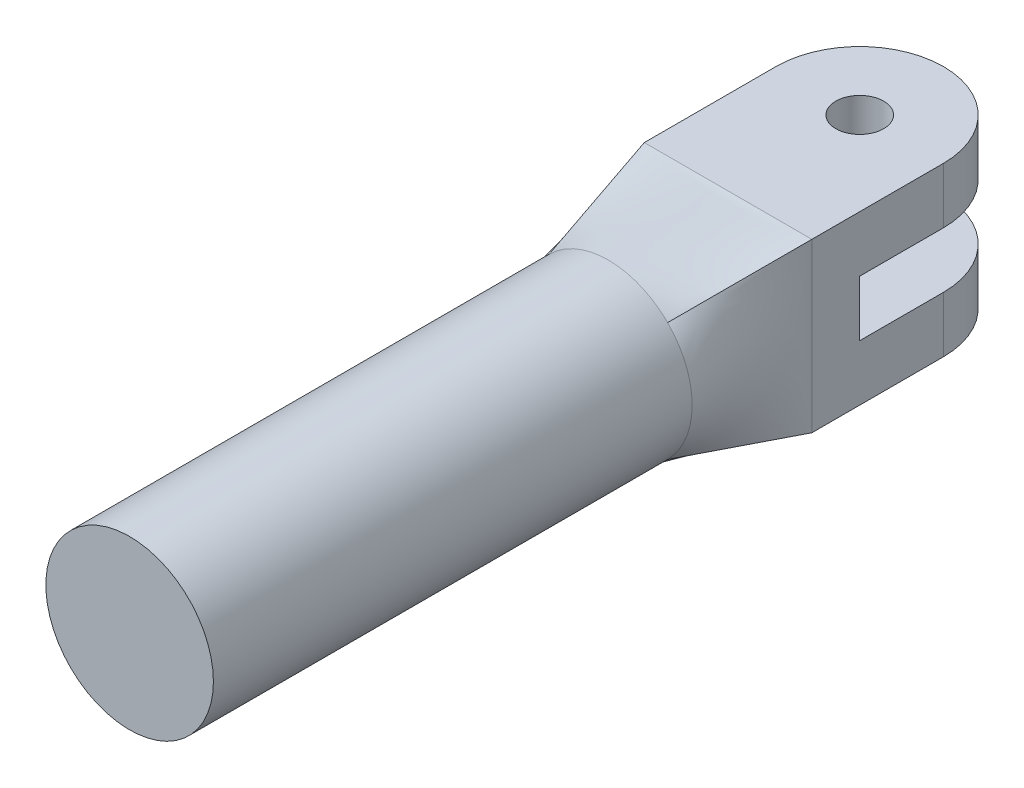
from build123d import *

# Parameters (mm, degrees)
SKETCH1_R           = 3.5
BOSS_EXTRUDE1_DEPTH = 20
SKETCH3_2_W         = 7
SKETCH3_2_H         = 7
BOSS_EXTRUDE3_DEPTH = 2
SKETCH4_W           = 7
SKETCH4_H           = 2.333333333
BOSS_EXTRUDE2_DEPTH = 7
SKETCH5_R           = 1
CUT_EXTRUDE1_DEPTH  = 35.889110176
FILLET1_R           = 3.5


with BuildPart() as part:
    # Sketch1 → Boss-Extrude1 (new body)
    with BuildSketch(Plane.XY):
        Circle(SKETCH1_R)
    extrude(amount=-BOSS_EXTRUDE1_DEPTH)

    # Loft1: read off the stored shape, not the designer's step
    # Loft1: loft between two sections, ruled curve by curve
    loft1_from = [
        Edge.make_bspline([(-3.5, 3.5, -25), (-3.5, 2.916666667, -25), (-3.5, 2.333333333, -25), (-3.5, 1.166666667, -25), (-3.5, 0.583333333, -25), (-3.5, -0.583333333, -25), (-3.5, -1.166666667, -25), (-3.5, -2.333333333, -25), (-3.5, -2.916666667, -25), (-3.5, -3.5, -25)], [0, 0, 0, 0, 0.25, 0.25, 0.5, 0.5, 0.75, 0.75, 1, 1, 1, 1], 3),
        Edge.make_bspline([(-3.5, -3.5, -25), (-2.916666667, -3.5, -25), (-2.333333333, -3.5, -25), (-1.166666667, -3.5, -25), (-0.583333333, -3.5, -25), (0.583333333, -3.5, -25), (1.166666667, -3.5, -25), (2.333333333, -3.5, -25), (2.916666667, -3.5, -25), (3.5, -3.5, -25)], [0, 0, 0, 0, 0.25, 0.25, 0.5, 0.5, 0.75, 0.75, 1, 1, 1, 1], 3),
        Edge.make_bspline([(3.5, 3.5, -25), (2.916666667, 3.5, -25), (2.333333333, 3.5, -25), (1.166666667, 3.5, -25), (0.583333333, 3.5, -25), (-0.583333333, 3.5, -25), (-1.166666667, 3.5, -25), (-2.333333333, 3.5, -25), (-2.916666667, 3.5, -25), (-3.5, 3.5, -25)], [0, 0, 0, 0, 0.25, 0.25, 0.5, 0.5, 0.75, 0.75, 1, 1, 1, 1], 3),
        Edge.make_bspline([(3.5, -3.5, -25), (3.5, -2.916666667, -25), (3.5, -2.333333333, -25), (3.5, -1.166666667, -25), (3.5, -0.583333333, -25), (3.5, 0.583333333, -25), (3.5, 1.166666667, -25), (3.5, 2.333333333, -25), (3.5, 2.916666667, -25), (3.5, 3.5, -25)], [0, 0, 0, 0, 0.25, 0.25, 0.5, 0.5, 0.75, 0.75, 1, 1, 1, 1], 3),
    ]
    loft1_to = [
        Edge.make_bspline([(-2.474873734, 2.474873734, -20), (-2.766540401, 2.183207067, -20), (-3.028055087, 1.815378049, -20), (-3.396138059, 0.964863384, -20), (-3.5, 0.483249156, -20), (-3.5, -0.483249156, -20), (-3.396138059, -0.964863384, -20), (-3.028055087, -1.815378049, -20), (-2.766540401, -2.183207067, -20), (-2.474873734, -2.474873734, -20)], [0, 0, 0, 0, 0.25, 0.25, 0.5, 0.5, 0.75, 0.75, 1, 1, 1, 1], 3),
        Edge.make_bspline([(-2.474873734, -2.474873734, -20), (-2.183207067, -2.766540401, -20), (-1.815378049, -3.028055087, -20), (-0.964863384, -3.396138059, -20), (-0.483249156, -3.5, -20), (0.483249156, -3.5, -20), (0.964863384, -3.396138059, -20), (1.815378049, -3.028055087, -20), (2.183207067, -2.766540401, -20), (2.474873734, -2.474873734, -20)], [0, 0, 0, 0, 0.25, 0.25, 0.5, 0.5, 0.75, 0.75, 1, 1, 1, 1], 3),
        Edge.make_bspline([(2.474873734, 2.474873734, -20), (2.183207067, 2.766540401, -20), (1.815378049, 3.028055087, -20), (0.964863384, 3.396138059, -20), (0.483249156, 3.5, -20), (-0.483249156, 3.5, -20), (-0.964863384, 3.396138059, -20), (-1.815378049, 3.028055087, -20), (-2.183207067, 2.766540401, -20), (-2.474873734, 2.474873734, -20)], [0, 0, 0, 0, 0.25, 0.25, 0.5, 0.5, 0.75, 0.75, 1, 1, 1, 1], 3),
        Edge.make_bspline([(2.474873734, -2.474873734, -20), (2.766540401, -2.183207067, -20), (3.028055087, -1.815378049, -20), (3.396138059, -0.964863384, -20), (3.5, -0.483249156, -20), (3.5, 0.483249156, -20), (3.396138059, 0.964863384, -20), (3.028055087, 1.815378049, -20), (2.766540401, 2.183207067, -20), (2.474873734, 2.474873734, -20)], [0, 0, 0, 0, 0.25, 0.25, 0.5, 0.5, 0.75, 0.75, 1, 1, 1, 1], 3),
    ]
    loft1 = Solid(Shell([*[Face.make_surface_from_curves(loft1_from[k], loft1_to[k]) for k in range(4)], Face(Wire(loft1_from)), Face(Wire(loft1_to))]))
    add(loft1)

    # Sketch3<2> → Boss-Extrude3 (add)
    with BuildSketch(Plane(origin=(0, 0, -25), x_dir=(-1, 0, 0), z_dir=(0, 0, -1))):
        Rectangle(SKETCH3_2_W, SKETCH3_2_H)
    extrude(amount=BOSS_EXTRUDE3_DEPTH)

    # Sketch4 → Boss-Extrude2 (add)
    with BuildSketch(Plane(origin=(0, 0, -27), x_dir=(-1, 0, 0), z_dir=(0, 0, -1))):
        with Locations((0, 2.333333334)):
            Rectangle(SKETCH4_W, SKETCH4_H)
        with Locations((0, -2.333333334)):
            Rectangle(SKETCH4_W, SKETCH4_H)
    extrude(amount=BOSS_EXTRUDE2_DEPTH)

    # Sketch5 → Cut-Extrude1 (cut, through all)
    with BuildSketch(Plane(origin=(0, 3.5, 0), x_dir=(1, 0, 0), z_dir=(0, 1, 0))):
        with Locations(Location((0, 30.5, 0), (0, 0, 270))):
            Circle(SKETCH5_R)
    extrude(amount=-CUT_EXTRUDE1_DEPTH, mode=Mode.SUBTRACT)

    # Fillet1
    fillet1_edges = [part.edges().sort_by_distance(p)[0] for p in [
        (-3.5, 2.333333333, -34),
        (-3.5, -2.333333333, -34),
        (3.5, -2.333333333, -34),
        (3.5, 2.333333333, -34),
    ]]
    fillet(fillet1_edges, radius=FILLET1_R - 0.0001)  # a hair under: the kernel refuses the full size


solid = part.part
